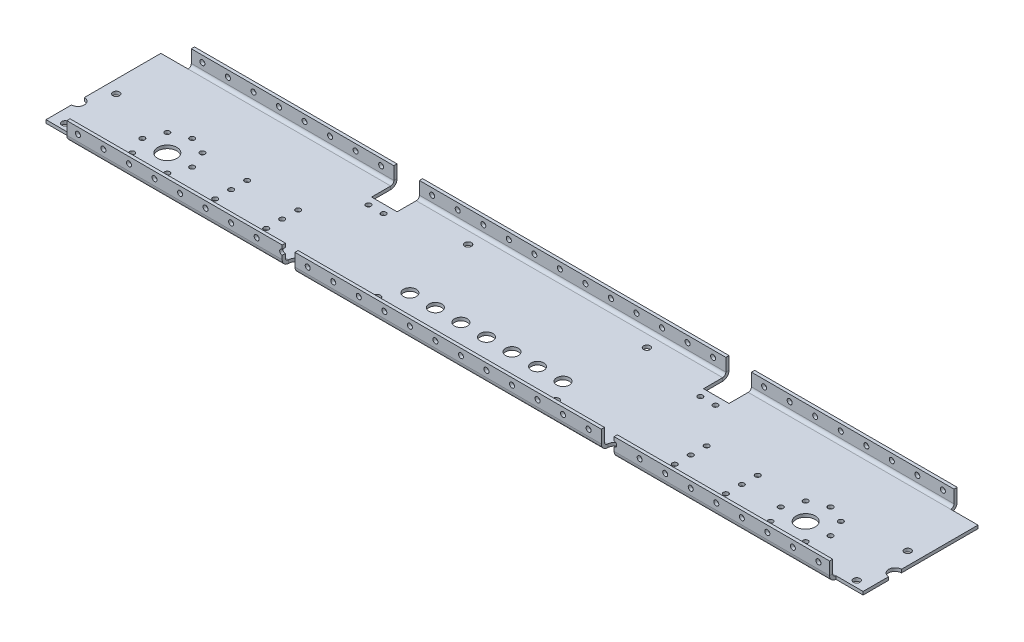
from build123d import *

# Parameters (mm, degrees)
SKETCH1_W                      = 812.8
SKETCH1_H                      = 127
BASE_FLANGE1_DEPTH             = 3.175
EDGE_FLANGE1_STRIP_W           = 19.05
EDGE_FLANGE1_STRIP_H           = 3.175
EDGE_FLANGE1_STRIP_CUT_DEPTH   = 812.8
EDGE_FLANGE1_STRIP_2_W         = 19.05
EDGE_FLANGE1_STRIP_2_H         = 3.175
EDGE_FLANGE1_STRIP_CUT_2_DEPTH = 812.8
EDGE_FLANGE1_DEPTH             = 812.8
EDGE_FLANGE1_BEND_DEPTH        = 812.8
MOUNTING_HOLES_D               = 5
LPATTERN3_COUNT                = 32
LPATTERN3_PITCH                = 25.4
SKETCH21_W                     = 27.051
SKETCH21_H                     = 6.35
SKETCH21_W_2                   = 25.4
SKETCH21_H_2                   = 25.4
CUT_EXTRUDE3_DEPTH             = 412.771918057
CUT_EXTRUDE4_DEPTH             = 412.637250045
CUT_EXTRUDE4_DEPTH_BACK        = 412.637250045
F_80_20_CONNECTION_HOLES_D     = 6.6
MOTOR_HOLES_D                  = 19.05
F_1_2_0_5_DIAMETER_HOLE1_D     = 12.7
CUT_EXTRUDE5_DEPTH             = 412.637250045
CHURROW_HOLES_D                = 6.6
F_80_20_SUPPORT_HOLES_D        = 5
MOTOR_GEARBOX_MOUNTS_D         = 5
F_5_0MM_DOWEL_HOLE3_D          = 5


# Sheet-metal steps are written as plain solids
with BuildPart() as part:
    # Sketch1 → Base-Flange1 (new body)
    with BuildSketch(Plane(origin=(0, 0, 0), x_dir=(1, 0, 0), z_dir=(0, 1, 0))):
        Rectangle(SKETCH1_W, SKETCH1_H)
    extrude(amount=-BASE_FLANGE1_DEPTH)

    # Edge-Flange1 strip (across the edge) → Edge-Flange1 strip cut (cut)
    with BuildSketch(Plane(origin=(406.4, 0, -63.5), x_dir=(0, 0, 1), z_dir=(-1, 0, 0))):
        with Locations((-3.175, -1.5875)):
            Rectangle(EDGE_FLANGE1_STRIP_W, EDGE_FLANGE1_STRIP_H)
    extrude(amount=EDGE_FLANGE1_STRIP_CUT_DEPTH, mode=Mode.SUBTRACT)

    # Edge-Flange1 strip 2 (across the edge) → Edge-Flange1 strip cut 2 (cut)
    with BuildSketch(Plane(origin=(-406.4, 0, 63.5), x_dir=(0, 0, -1), z_dir=(1, 0, 0))):
        with Locations((-3.175, -1.5875)):
            Rectangle(EDGE_FLANGE1_STRIP_2_W, EDGE_FLANGE1_STRIP_2_H)
    extrude(amount=EDGE_FLANGE1_STRIP_CUT_2_DEPTH, mode=Mode.SUBTRACT)

    # Edge-Flange1 section (across the edge) → Edge-Flange1 (add)
    with BuildSketch(Plane(origin=(406.4, 0, -63.5), x_dir=(0, 0, 1), z_dir=(-1, 0, 0))):
        with BuildLine():
            Line((0, 3.175), (0, 15.875))
            Line((0, 15.875), (3.175, 15.875))
            Line((3.175, 15.875), (3.175, 3.175))
            ThreePointArc((3.175, 3.175), (4.10493597, 0.92993597), (6.35, 0))
            Line((6.35, 0), (6.35, -3.175))
            ThreePointArc((6.35, -3.175), (1.859871939, -1.315128061), (0, 3.175))
        make_face()
    extrude(amount=EDGE_FLANGE1_DEPTH)

    # Edge-Flange1 section 2 (across the edge) → Edge-Flange1 bend (add)
    with BuildSketch(Plane(origin=(-406.4, 0, 63.5), x_dir=(0, 0, -1), z_dir=(1, 0, 0))):
        with BuildLine():
            Line((0, 3.175), (0, 15.875))
            Line((0, 15.875), (3.175, 15.875))
            Line((3.175, 15.875), (3.175, 3.175))
            ThreePointArc((3.175, 3.175), (4.10493597, 0.92993597), (6.35, 0))
            Line((6.35, 0), (6.35, -3.175))
            ThreePointArc((6.35, -3.175), (1.859871939, -1.315128061), (0, 3.175))
        make_face()
    extrude(amount=EDGE_FLANGE1_BEND_DEPTH)

    # Mounting Holes (through all)
    with Locations(Plane(origin=(342.9, 0, -63.5), x_dir=(1, 0, 0), z_dir=(0, 0, -1))):
        with Locations((-736.6, -9.525)):
            mounting_holes = Hole(MOUNTING_HOLES_D / 2)

    # LPattern3: Mounting Holes ×32
    with Locations(*[(i * LPATTERN3_PITCH, 0, 0) for i in range(1, LPATTERN3_COUNT)]):
        add(mounting_holes, mode=Mode.SUBTRACT)

    # Sketch21 → Cut-Extrude3 (cut, through all)
    with BuildSketch(Plane.XZ.offset(3.175)):
        with Locations((-392.8745, -60.325)):
            Rectangle(SKETCH21_W, SKETCH21_H)
        with Locations((165.1, -50.8)):
            Rectangle(SKETCH21_W_2, SKETCH21_H_2)
        with Locations((-165.1, -50.8)):
            Rectangle(SKETCH21_W_2, SKETCH21_H_2)
        with Locations((-392.8745, 60.325)):
            Rectangle(SKETCH21_W, SKETCH21_H)
        with Locations((392.8745, -60.325)):
            Rectangle(SKETCH21_W, SKETCH21_H)
        with Locations((392.8745, 60.325)):
            Rectangle(SKETCH21_W, SKETCH21_H)
    extrude(amount=-CUT_EXTRUDE3_DEPTH, mode=Mode.SUBTRACT)

    # Sketch26 → Cut-Extrude4 (cut, two sides: drawn at the far end of the back side and taken through both)
    with BuildSketch(Plane(origin=(0, 0, 0), x_dir=(1, 0, 0), z_dir=(0, 1, 0)).offset(-CUT_EXTRUDE4_DEPTH_BACK)):
        with BuildLine():
            Line((152.4, -57.15), (152.4, -63.5))
            Line((152.4, -63.5), (165.1, -63.5))
            Line((165.1, -63.5), (165.1, -57.15))
            ThreePointArc((165.1, -57.15), (158.75, -50.8), (152.4, -57.15))
        make_face()
        with BuildLine():
            Line((-165.1, -57.15), (-165.1, -63.5))
            Line((-165.1, -63.5), (-152.4, -63.5))
            Line((-152.4, -63.5), (-152.4, -57.15))
            ThreePointArc((-152.4, -57.15), (-158.75, -50.8), (-165.1, -57.15))
        make_face()
    extrude(amount=CUT_EXTRUDE4_DEPTH + CUT_EXTRUDE4_DEPTH_BACK, mode=Mode.SUBTRACT)

    # 80/20 Connection Holes (through all)
    with Locations(Plane(origin=(0, 0, 0), x_dir=(1, 0, 0), z_dir=(0, 1, 0))):
        with Locations((-393.7, 0), (-393.7, -50.8), (393.7, -50.8), (393.7, 0)):
            Hole(F_80_20_CONNECTION_HOLES_D / 2)

    # Motor Holes (through all)
    with Locations(Plane(origin=(0, 0, 0), x_dir=(1, 0, 0), z_dir=(0, 1, 0))):
        with Locations((-317.5, -25.4), (317.5, -25.4)):
            Hole(MOTOR_HOLES_D / 2)

    # 1/2 (0.5) Diameter Hole1 (through all)
    with Locations(Plane(origin=(0, 0, 0), x_dir=(1, 0, 0), z_dir=(0, 1, 0))):
        with Locations((76.2, -25.4), (0, -25.4), (-25.4, -25.4), (-50.8, -25.4), (-76.2, -25.4), (25.4, -25.4), (50.8, -25.4)):
            Hole(F_1_2_0_5_DIAMETER_HOLE1_D / 2)

    # Sketch33 → Cut-Extrude5 (cut, through all)
    with BuildSketch(Plane(origin=(0, 0, 0), x_dir=(1, 0, 0), z_dir=(0, 1, 0))):
        with BuildLine():
            Line((-406.4, -19.05), (-406.4, -31.75))
            ThreePointArc((-406.4, -31.75), (-400.05, -25.4), (-406.4, -19.05))
        make_face()
        with BuildLine():
            Line((406.4, -19.05), (406.4, -31.75))
            ThreePointArc((406.4, -31.75), (400.05, -25.4), (406.4, -19.05))
        make_face()
    extrude(amount=-CUT_EXTRUDE5_DEPTH, mode=Mode.SUBTRACT)

    # Churrow Holes (through all)
    with Locations(Plane(origin=(0, 0, 0), x_dir=(1, 0, 0), z_dir=(0, 1, 0))):
        with Locations((88.9, -45.28), (-88.9, 45.28), (-88.9, -45.28), (88.9, 45.28)):
            Hole(CHURROW_HOLES_D / 2)

    # 80/20 Support Holes (through all)
    with Locations(Plane(origin=(0, 0, 0), x_dir=(1, 0, 0), z_dir=(0, 1, 0))):
        with Locations((172.6, 29.8), (-172.6, 29.8), (-157.6, 29.8), (157.6, 29.8)):
            Hole(F_80_20_SUPPORT_HOLES_D / 2)

    # Motor Gearbox Mounts (through all)
    with Locations(Plane(origin=(0, 0, 0), x_dir=(1, 0, 0), z_dir=(0, 1, 0))):
        with Locations((-299.999107166, -7.899107166), (317.5, -0.65), (299.999107166, -7.899107166), (292.75, -25.4), (299.999107166, -42.900892834), (317.5, -50.15), (335.000892834, -42.900892834), (342.25, -25.4), (335.000892834, -7.899107166), (-317.5, -0.65), (-335.000892834, -7.899107166), (-342.25, -25.4), (-335.000892834, -42.900892834), (-317.5, -50.15), (-299.999107166, -42.900892834), (-292.75, -25.4)):
            Hole(MOTOR_GEARBOX_MOUNTS_D / 2)

    # Ø5.0mm Dowel Hole3 (through all)
    with Locations(Plane(origin=(0, 0, 0), x_dir=(1, 0, 0), z_dir=(0, 1, 0))):
        with Locations((203.2, -41.275), (-254, -25.4), (-203.2, -25.4), (-254, -9.525), (-203.2, -9.525), (-203.2, -41.275), (-254, -41.275), (254, -25.4), (203.2, -25.4), (203.2, -9.525), (254, -9.525), (254, -41.275)):
            Hole(F_5_0MM_DOWEL_HOLE3_D / 2)


solid = part.part
